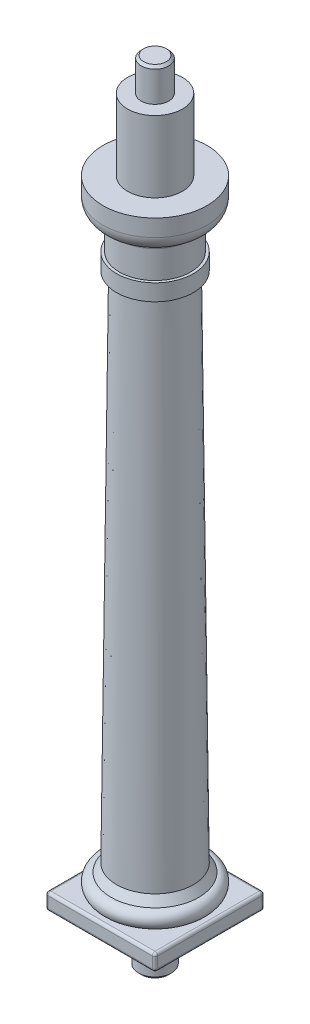
from build123d import *

# Parameters (mm, degrees)
SKETCH1_W           = 20
SKETCH1_H           = 20
SKETCH1_R           = 3
BOSS_EXTRUDE1_DEPTH = 3
FILLET1_R           = 0.5


# Read off the part's stored shape, not the designer's step: M6x1.0 Machine Threads Stud1, M5x0.8 Machine Threads Stud1
with BuildPart() as part:
    # Sketch1 → Boss-Extrude1 (new body)
    with BuildSketch(Plane(origin=(0, 0, 0), x_dir=(1, 0, 0), z_dir=(0, 1, 0))):
        Rectangle(SKETCH1_W, SKETCH1_H)
        with Locations(Location((0, 0, 0), (0, 0, 270))):
            Circle(SKETCH1_R, mode=Mode.SUBTRACT)
    extrude(amount=BOSS_EXTRUDE1_DEPTH)

    # Sketch2 → Revolve1 (revolve)
    with BuildSketch(Plane.XY, mode=Mode.PRIVATE) as revolve1_sk:
        with BuildLine():
            Line((-3, 7.5), (-7, 7.5))
            Line((-7, 7.5), (-8, 6))
            ThreePointArc((-8, 6), (-9.499999777, 4.499999889), (-7.999999777, 3))
            Line((-7.999999777, 3), (-3, 3))
            Line((-3, 3), (-3, 7.5))
        make_face()
    revolve(revolve1_sk.sketch.rotate(Axis((0, 13.88184313, 0), (0, -1, 0)), 270), axis=Axis((0, 13.88184313, 0), (0, -1, 0)))

    # Sketch3 → Revolve2 (revolve)
    with BuildSketch(Plane.XY, mode=Mode.PRIVATE) as revolve2_sk:
        Polygon((0, 7.5), (0, 101), (-6, 101), (-7, 7.5), align=None)
        Polygon((0, 101), (0, 104), (-7, 104), (-7, 101), (-6, 101), align=None)
    revolve(revolve2_sk.sketch.rotate(Axis((0, 134.623690835, 0), (0, -1, 0)), 270), axis=Axis((0, 134.623690835, 0), (0, -1, 0)))

    # Sketch4 → Revolve3 (revolve)
    with BuildSketch(Plane.XY, mode=Mode.PRIVATE) as revolve3_sk:
        with BuildLine():
            Line((-2.5, 129), (-5, 129))
            Line((-5, 129), (-5, 116))
            Line((-5, 116), (-9.5, 116))
            Line((-9.5, 116), (-9.5, 112.90473751))
            ThreePointArc((-9.5, 112.90473751), (-8.871708245, 111.067620203), (-7.25, 110))
            ThreePointArc((-7.25, 110), (-6.709430585, 109.644126599), (-6.5, 109.031754163))
            Line((-6.5, 109.031754163), (-6.5, 104))
            Line((-6.5, 104), (-2.5, 104))
            Line((-2.5, 104), (-2.5, 129))
        make_face()
    revolve(revolve3_sk.sketch.rotate(Axis((0, 159.390793399, 0), (0, -1, 0)), 270), axis=Axis((0, 159.390793399, 0), (0, -1, 0)))

    # Fillet1
    fillet1_edges = [part.edges().sort_by_distance(p)[0] for p in [
        (-10, 3, 0),
        (0, 3, 10),
        (10, 3, 0),
        (0, 0, 10),
        (-10, 0, 0),
        (0, 0, -10),
        (10, 0, 0),
        (10, 1.5, 10),
        (-10, 1.5, 10),
        (-10, 1.5, -10),
        (10, 1.5, -10),
        (0, 3, -10),
    ]]
    fillet(fillet1_edges, radius=FILLET1_R)

    # M6x1.0 Machine Threads Stud1 outline → M6x1.0 Machine Threads Stud1 (revolve)
    with BuildSketch(Plane.XY):
        Polygon((0, 7.5), (0, -9), (2.4455, -9), (3, -8.4455), (3, 7.5), align=None)
    revolve(axis=Axis((0, 0, 0), (0, 1, 0)))

    # M5x0.8 Machine Threads Stud1 outline → M5x0.8 Machine Threads Stud1 (revolve)
    with BuildSketch(Plane.XY):
        Polygon((2.055, 135), (0, 135), (0, 104), (2.5, 104), (2.5, 134.555), align=None)
    revolve(axis=Axis((0, 0, 0), (0, 1, 0)))


solid = part.part
